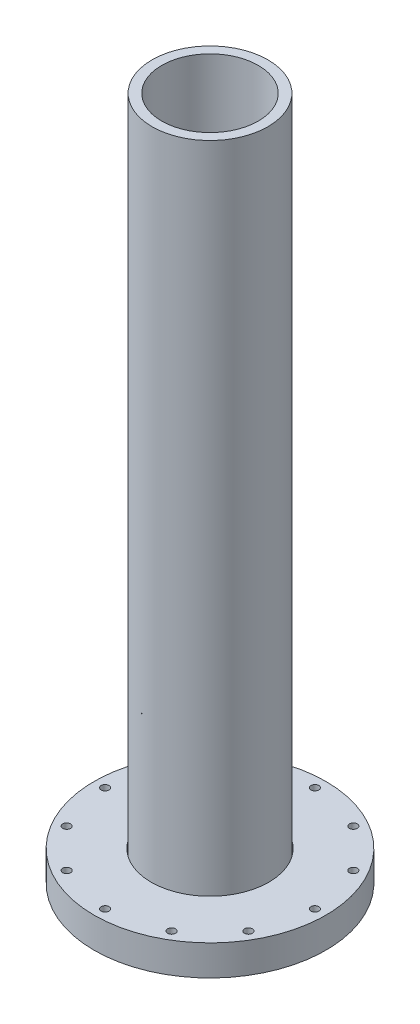
from build123d import *

# Parameters (mm, degrees)
SKETCH1_R           = 38.1
SKETCH1_R_2         = 31.75
BOSS_EXTRUDE1_DEPTH = 450
SKETCH2_R           = 76.2
SKETCH2_R_2         = 38.6715
BOSS_EXTRUDE2_DEPTH = 20
SKETCH5_W           = 2.5908
SKETCH5_H           = 450
CIRPATTERN1_COUNT   = 12
SKETCH6_R           = 55.14
CUT_EXTRUDE1_DEPTH  = 2


with BuildPart() as part:
    # Sketch1 → Boss-Extrude1 (new body)
    with BuildSketch(Plane(origin=(0, 0, 0), x_dir=(1, 0, 0), z_dir=(0, 1, 0))):
        Circle(SKETCH1_R)
        Circle(SKETCH1_R_2, mode=Mode.SUBTRACT)
    extrude(amount=BOSS_EXTRUDE1_DEPTH)


with BuildPart() as body_2:
    # Sketch2 → Boss-Extrude2 (new body)
    with BuildSketch(Plane(origin=(0, 0, 0), x_dir=(1, 0, 0), z_dir=(0, 1, 0))):
        Circle(SKETCH2_R)
        Circle(SKETCH2_R_2, mode=Mode.SUBTRACT)
    extrude(amount=BOSS_EXTRUDE2_DEPTH)

    # Sketch5 → #6 (0.204) Diameter Hole1 (revolve, cut)
    with BuildSketch(Plane(origin=(69, 0, 0), x_dir=(0, 0, -1), z_dir=(1, 0, 0))):
        with Locations((1.2954, 225)):
            Rectangle(SKETCH5_W, SKETCH5_H)
    f_6_0_204_diameter_hole1 = revolve(axis=Axis((69, -6.35, 0), (0, 1, 0)), mode=Mode.SUBTRACT)

    # CirPattern1: #6 (0.204) Diameter Hole1 ×12 about axis
    cirpattern1_axis = Axis((0, 472.5, 0), (0, -1, 0))
    for i in range(1, CIRPATTERN1_COUNT):
        add(f_6_0_204_diameter_hole1.rotate(cirpattern1_axis, i * 360 / CIRPATTERN1_COUNT), mode=Mode.SUBTRACT)


with BuildPart() as cut_extrude1_tool:
    # Sketch6 → Cut-Extrude1 (new body)
    with BuildSketch(Plane.XZ):
        Circle(SKETCH6_R)
    extrude(amount=-CUT_EXTRUDE1_DEPTH)


with BuildPart() as part_1:
    add(part.part)

    # Cut-Extrude1: cut by cut_extrude1_tool
    add(cut_extrude1_tool.part, mode=Mode.SUBTRACT)


with BuildPart() as body_2_1:
    add(body_2.part)

    # Cut-Extrude1: cut by cut_extrude1_tool
    add(cut_extrude1_tool.part, mode=Mode.SUBTRACT)


solid = Compound([part_1.part, body_2_1.part])
